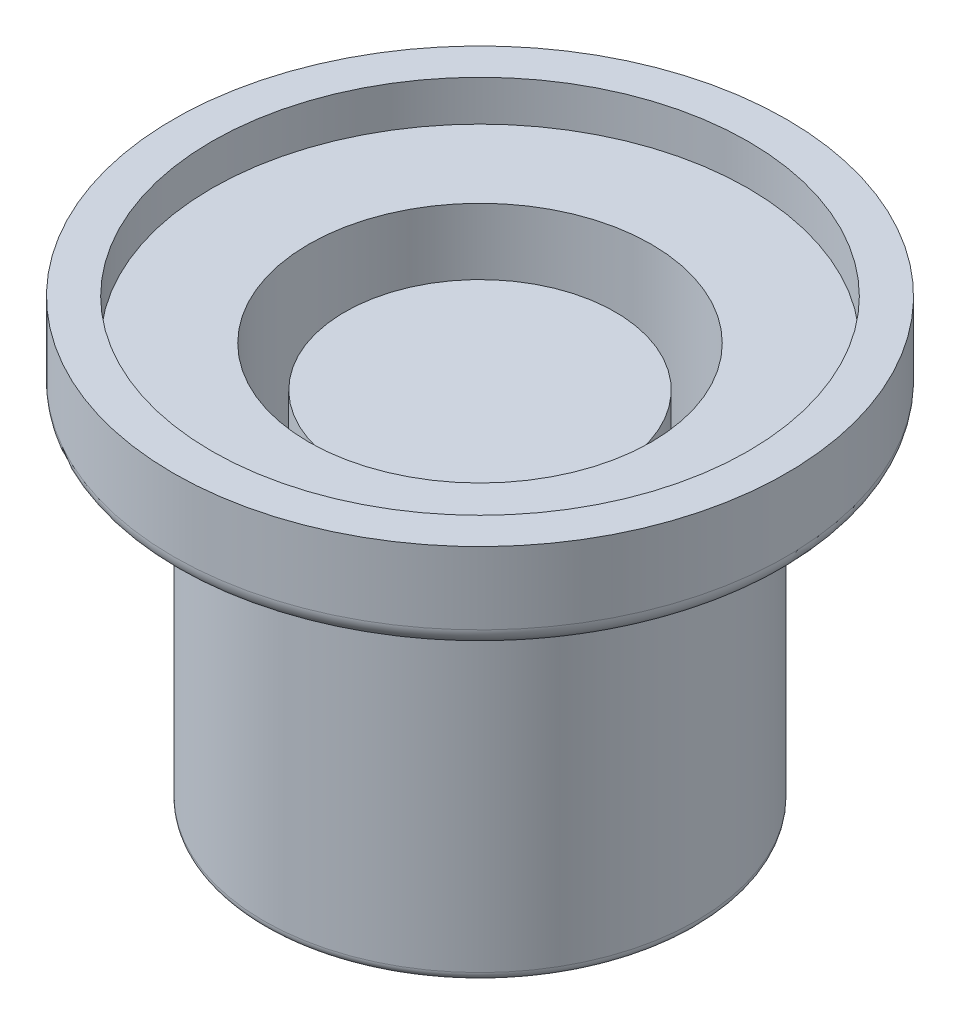
from build123d import *

# Parameters (mm, degrees)
FILLET1_R          = 0.2
SKETCH1_R          = 2.974873734
CUT_EXTRUDE1_DEPTH = 0.45


# Read off the part's stored shape, not the designer's step: Stock-Finger_Rubber_Sensor+Button-1
with BuildPart() as part:
    # Stock-Finger_Rubber_Sensor+Button-1 outl → Stock-Finger_Rubber_Sensor+Button-1 (revolve)
    with BuildSketch(Plane.XY.offset(29.325)):
        with BuildLine():
            Line((1.9, 3.4), (1.9, -0.158502039))
            Line((1.9, -0.158502039), (1.5, -0.158502039))
            Line((1.5, -0.158502039), (1.5, 2.5))
            Line((1.5, 2.5), (0, 2.5))
            Line((0, 2.5), (0, -1.498502039))
            Line((0, -1.498502039), (2.3, -1.498502039))
            ThreePointArc((2.3, -1.498502039), (2.370710678, -1.469212717), (2.4, -1.398502039))
            Line((2.4, -1.398502039), (2.4, 2.4))
            Line((2.4, 2.4), (3.4, 2.4))
            Line((3.4, 2.4), (3.4, 3.4))
            Line((3.4, 3.4), (1.9, 3.4))
        make_face()
    revolve(axis=Axis((0, 0, 29.325), (0, 1, 0)))

    # Fillet1
    fillet1_edges = [part.edges().sort_by_distance(p)[0] for p in [
        (-3.4, 2.4, 29.325),
    ]]
    fillet(fillet1_edges, radius=FILLET1_R)

    # Sketch1 → Cut-Extrude1 (cut)
    with BuildSketch(Plane(origin=(0, 3.4, 0), x_dir=(1, 0, 0), z_dir=(0, 1, 0))):
        with Locations(Location((0, -29.325, 0), (0, 0, 270))):
            Circle(SKETCH1_R)
    extrude(amount=-CUT_EXTRUDE1_DEPTH, mode=Mode.SUBTRACT)


solid = part.part
